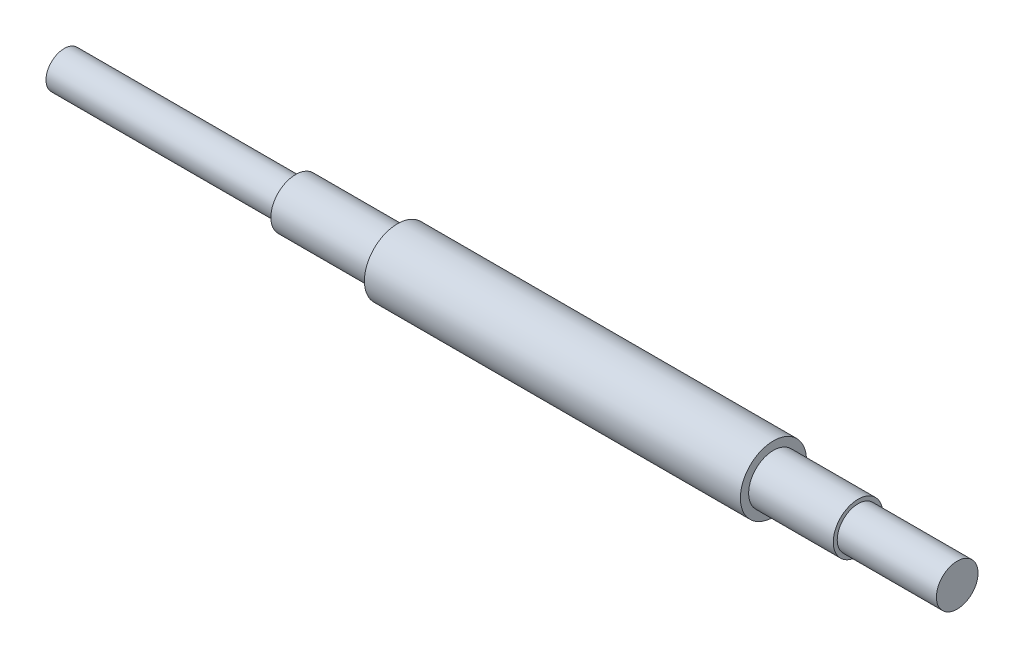
from build123d import *


with BuildPart() as part:
    # Sketch1 → Revolve1 (revolve)
    with BuildSketch(Plane(origin=(0, 0, 0), x_dir=(1, 0, 0), z_dir=(0, 1, 0))):
        Polygon((-78.63058905, 0), (-78.63058905, 3.499993), (-34.18058905, 3.499993), (-34.18058905, 4.7625), (-14.62258905, 4.7625), (-14.62258905, 6.35), (57.59737095, 6.35), (57.59737095, 4.7625), (73.85337095, 4.7625), (73.85337095, 3.99923), (92.90337095, 3.99923), (92.90337095, 0), align=None)
    revolve(axis=Axis((-97.950567047, 0, 0), (1, 0, 0)))


solid = part.part
